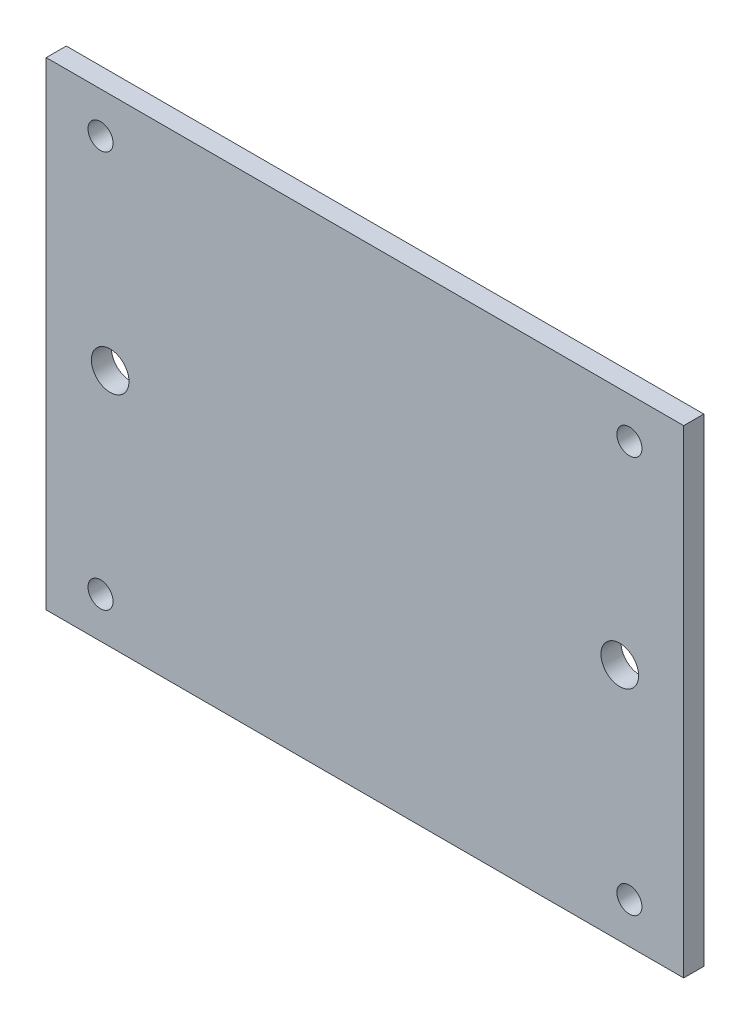
from build123d import *

# Parameters (mm, degrees)
SKETCH1_W           = 50.84
SKETCH1_H           = 38.15
SKETCH1_R           = 1
SKETCH1_R_2         = 1.5
BOSS_EXTRUDE1_DEPTH = 1.6


with BuildPart() as part:
    # Sketch1 → Boss-Extrude1 (new body)
    with BuildSketch(Plane.XY):
        Rectangle(SKETCH1_W, SKETCH1_H)
        with Locations((-21.088938401, 15.825)):
            Circle(SKETCH1_R, mode=Mode.SUBTRACT)
        with Locations((21.088938401, 15.825)):
            Circle(SKETCH1_R, mode=Mode.SUBTRACT)
        with Locations((21.088938401, -15.825)):
            Circle(SKETCH1_R, mode=Mode.SUBTRACT)
        with Locations((-21.088938401, -15.825)):
            Circle(SKETCH1_R, mode=Mode.SUBTRACT)
        with Locations((-20.32, 0)):
            Circle(SKETCH1_R_2, mode=Mode.SUBTRACT)
        with Locations((20.32, 0)):
            Circle(SKETCH1_R_2, mode=Mode.SUBTRACT)
    extrude(amount=BOSS_EXTRUDE1_DEPTH)


solid = part.part
